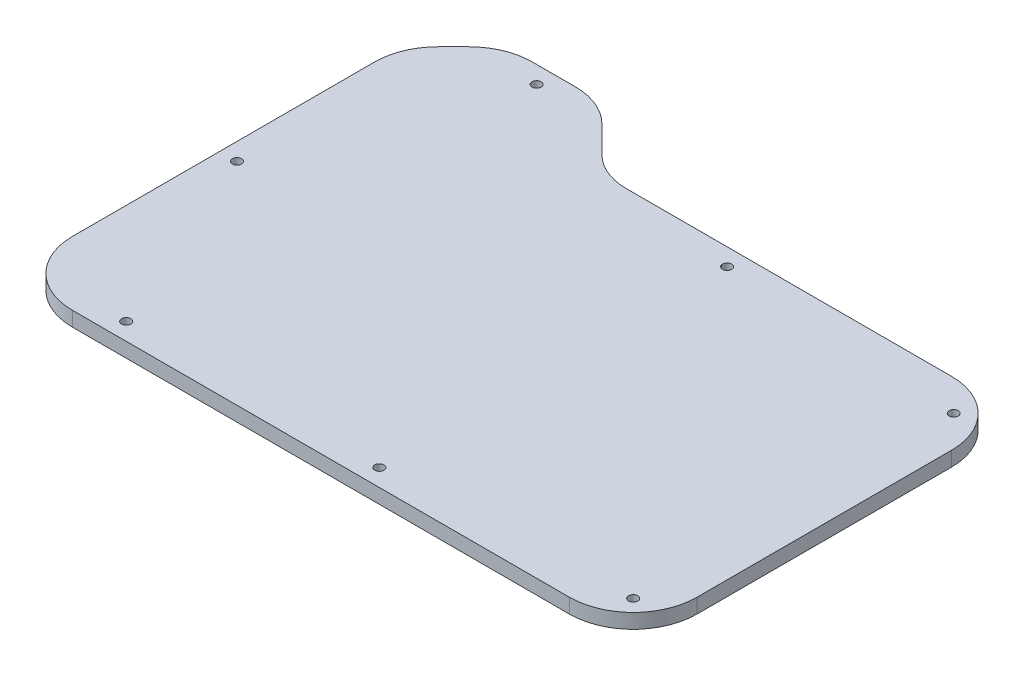
from build123d import *

# Parameters (mm, degrees)
SKETCH1_R           = 1
BOSS_EXTRUDE1_DEPTH = 3.175


with BuildPart() as part:
    # Sketch1 → Boss-Extrude1 (new body)
    with BuildSketch(Plane(origin=(0, 0, 0), x_dir=(1, 0, 0), z_dir=(0, 1, 0))):
        with BuildLine():
            Line((-37.221066228, -95.119565731), (-37.221066228, -39.819565731))
            ThreePointArc((-37.221066228, -39.819565731), (-41.277637309, -30.026136811), (-51.071066228, -25.96956573))
            Line((-51.071066228, -25.96956573), (-121.753952268, -25.96956573))
            ThreePointArc((-121.753952268, -25.96956573), (-126.61403186, -25.002835793), (-130.73420839, -22.249821851))
            Line((-130.73420839, -22.249821851), (-136.55789343, -16.426136811))
            ThreePointArc((-136.55789343, -16.426136811), (-141.051156811, -13.423834205), (-146.351322349, -12.36956573))
            Line((-146.351322349, -12.36956573), (-155.714324386, -12.36956573))
            ThreePointArc((-155.714324386, -12.36956573), (-161.014489924, -13.423834205), (-165.507753306, -16.426136811))
            Line((-165.507753306, -16.426136811), (-168.788009427, -19.706392932))
            ThreePointArc((-168.788009427, -19.706392932), (-171.790312033, -24.199656313), (-172.844580507, -29.499821851))
            Line((-172.844580507, -29.499821851), (-172.844580507, -95.119565731))
            ThreePointArc((-172.844580507, -95.119565731), (-168.788009427, -104.91299465), (-158.994580507, -108.969565731))
            Line((-158.994580507, -108.969565731), (-51.071066228, -108.969565731))
            ThreePointArc((-51.071066228, -108.969565731), (-41.277637309, -104.91299465), (-37.221066228, -95.119565731))
        make_face()
        with Locations((-169.094580507, -63.109693791)):
            Circle(SKETCH1_R, mode=Mode.SUBTRACT)
        with Locations((-151.032823368, -16.11956573)):
            Circle(SKETCH1_R, mode=Mode.SUBTRACT)
        with Locations((-96.075392509, -29.71956573)):
            Circle(SKETCH1_R, mode=Mode.SUBTRACT)
        with Locations((-43.929287738, -32.67778724)):
            Circle(SKETCH1_R, mode=Mode.SUBTRACT)
        with Locations((-43.929287738, -102.26134422)):
            Circle(SKETCH1_R, mode=Mode.SUBTRACT)
        with Locations((-96.075392509, -105.21956573)):
            Circle(SKETCH1_R, mode=Mode.SUBTRACT)
        with Locations((-151.032823368, -105.21956573)):
            Circle(SKETCH1_R, mode=Mode.SUBTRACT)
    extrude(amount=BOSS_EXTRUDE1_DEPTH)


solid = part.part
